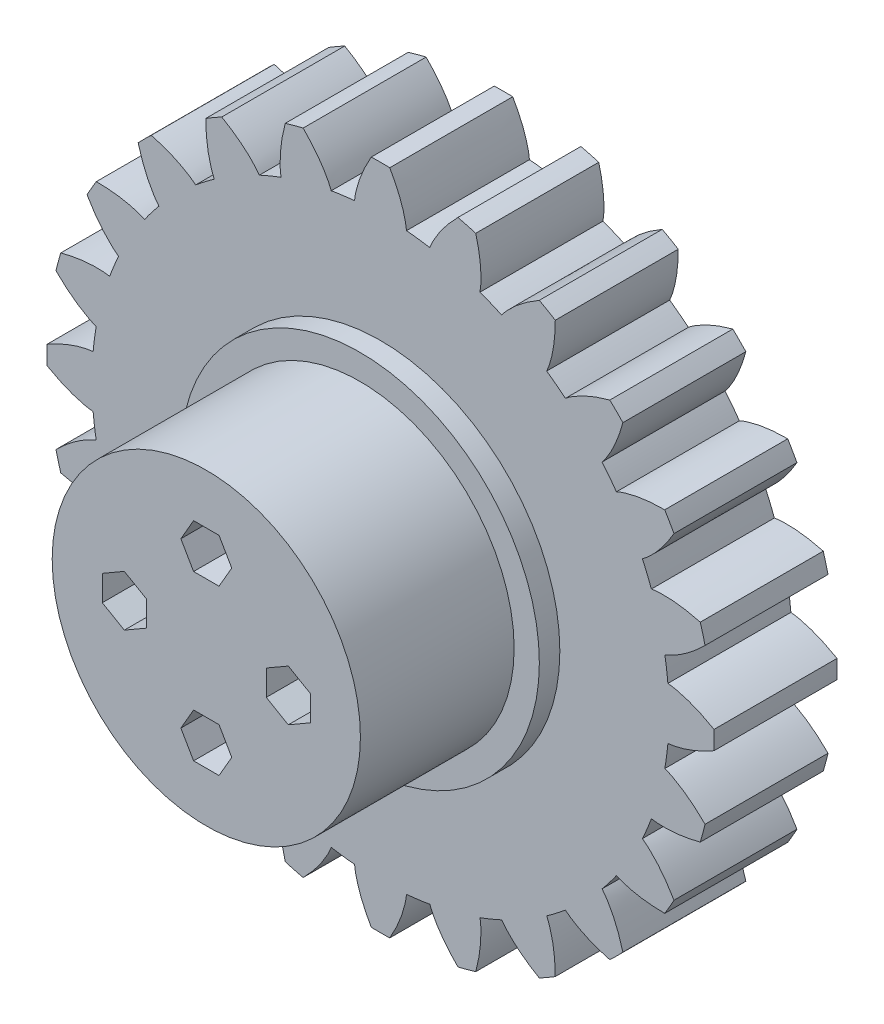
from build123d import *
from build123d.topology import SkipClean

# Parameters (mm, degrees)
SKETCH5_R            = 14.078874537
SKETCH5_R_2          = 1.5
EXTRUDE_BODY_DEPTH   = 3
EXTRUDE_TOOTH_DEPTH  = 3
CIRPATTERN1_COUNT    = 24
CUT_SPOKE_DEPTH      = 24.21644933
PATTERN_SPOKES_COUNT = 3
SCALE1_SCALE         = 2
SKETCH9_R            = 24.50429738
BOSS_EXTRUDE1_DEPTH  = 12
SKETCH10_R           = 17.5
BOSS_EXTRUDE2_DEPTH  = 2
SKETCH11_R           = 15.04
BOSS_EXTRUDE3_DEPTH  = 15
SKETCH12_R           = 1.1
CUT_EXTRUDE1_DEPTH   = 20
CUT_EXTRUDE2_DEPTH   = 29
CIRPATTERN2_COUNT    = 4
SKETCH14_R           = 3.431595381
SKETCH14_R_2         = 3.329011985
SKETCH14_R_3         = 3.465264164
SKETCH14_R_4         = 3.356633273
BOSS_EXTRUDE4_DEPTH  = 4
CUT_EXTRUDE3_REACH   = 56.415
SKETCH15_R           = 1.1


with BuildPart() as part:
    # Sketch5 → Extrude Body (new, symmetric)
    with BuildSketch(Plane.XY):
        Circle(SKETCH5_R)
        Circle(SKETCH5_R_2, mode=Mode.SUBTRACT)
    extrude(amount=EXTRUDE_BODY_DEPTH, both=True)

    # Sketch6 → Extrude Tooth (add, symmetric)
    with BuildSketch(Plane.XY):
        with BuildLine():
            Line((1.274269027, 13.788607604), (0.138033757, 1.493635391))
            ThreePointArc((0.138033757, 1.493635391), (0, 1.5), (-0.138033757, 1.493635391))
            Line((-0.138033757, 1.493635391), (-1.274269027, 13.788607604))
            add(Edge.make_bspline(
                [(-1.274269027, 13.788607604), (-1.281655886, 14.009204475), (-1.145793676, 14.886152234), (-0.779387603, 15.700986555), (-0.45055771, 16.272638198)],
                knots=[0, 0, 0, 0, 0.250018961, 1, 1, 1, 1], degree=3))
            ThreePointArc((-0.45055771, 16.272638198), (0, 16.278874537), (0.45055771, 16.272638198))
            add(Edge.make_bspline(
                [(1.274269027, 13.788607604), (1.281655886, 14.009204475), (1.145793676, 14.886152234), (0.779387603, 15.700986555), (0.45055771, 16.272638198)],
                knots=[0, 0, 0, 0, 0.250018961, 1, 1, 1, 1], degree=3))
        make_face()
    extrude_tooth = extrude(amount=EXTRUDE_TOOTH_DEPTH, both=True)

    # CirPattern1: Extrude Tooth ×24 about axis
    with SkipClean():  # the faces are left unmerged after this step: merging them gives an invalid solid
        cirpattern1_axis = Axis((0, 0, 3), (0, 0, -1))
        for i in range(1, CIRPATTERN1_COUNT):
            add(extrude_tooth.rotate(cirpattern1_axis, i * 360 / CIRPATTERN1_COUNT))

    # Sketch8 → Cut Spoke (cut, symmetric)
    with SkipClean():  # the faces are left unmerged after this step: merging them gives an invalid solid
        with BuildSketch(Plane.XY):
            with BuildLine():
                Line((1.5, 9.763898398), (1.5, 4.898979486))
                ThreePointArc((1.5, 4.898979486), (1.647197135, 4.376746518), (2.045454545, 4.008255943))
                ThreePointArc((2.045454545, 4.008255943), (3.897114317, 2.25), (4.493978744, -0.232712373))
                ThreePointArc((4.493978744, -0.232712373), (4.613972238, -0.761858695), (4.992640687, -1.150451637))
                Line((4.992640687, -1.150451637), (9.205784053, -3.582911093))
                ThreePointArc((9.205784053, -3.582911093), (10.083315936, -3.642882276), (10.668766975, -2.986448098))
                ThreePointArc((10.668766975, -2.986448098), (9.594586794, 5.539437268), (2.748043568, 10.732647276))
                ThreePointArc((2.748043568, 10.732647276), (1.886829374, 10.553848893), (1.5, 9.763898398))
            make_face()
        cut_spoke = extrude(amount=CUT_SPOKE_DEPTH, both=True, mode=Mode.SUBTRACT)

    # Pattern Spokes: Cut Spoke ×3 about axis
    with SkipClean():  # the faces are left unmerged after this step: merging them gives an invalid solid
        pattern_spokes_axis = Axis((0, 0, 0), (0, 0, 1))
        for i in range(1, PATTERN_SPOKES_COUNT):
            add(cut_spoke.rotate(pattern_spokes_axis, i * 360 / PATTERN_SPOKES_COUNT), mode=Mode.SUBTRACT)


with BuildPart() as part_1:
    # Scale1: scaled about (-5.63e-06, -6.117e-06, 0)
    add(part.part.scale(SCALE1_SCALE).moved(Location((5.63e-06, 6.117e-06, 0))))

    # Sketch9 → Boss-Extrude1 (add)
    with BuildSketch(Plane.XY.offset(6)):
        Circle(SKETCH9_R)
    extrude(amount=-BOSS_EXTRUDE1_DEPTH)

    # Sketch10 → Boss-Extrude2 (add)
    with BuildSketch(Plane.XY.offset(6)):
        Circle(SKETCH10_R)
    extrude(amount=BOSS_EXTRUDE2_DEPTH)

    # Sketch11 → Boss-Extrude3 (add)
    with BuildSketch(Plane.XY.offset(8)):
        Circle(SKETCH11_R)
    extrude(amount=BOSS_EXTRUDE3_DEPTH)

    # Sketch12 → Cut-Extrude1 (cut)
    with BuildSketch(Plane(origin=(0, 0, -6), x_dir=(-1, 0, 0), z_dir=(0, 0, -1))):
        with Locations((0, 8)):
            Circle(SKETCH12_R)
        with Locations((8, 0)):
            Circle(SKETCH12_R)
        with Locations((0, -8)):
            Circle(SKETCH12_R)
        with Locations((-8, 0)):
            Circle(SKETCH12_R)
    extrude(amount=-CUT_EXTRUDE1_DEPTH, mode=Mode.SUBTRACT)

    # Sketch13 → Cut-Extrude2 (cut)
    with BuildSketch(Plane(origin=(0, 0, -6), x_dir=(-1, 0, 0), z_dir=(0, 0, -1))):
        Polygon((1.241303079, -10.15), (-1.241303079, -10.15), (-2.482606158, -8), (-1.241303079, -5.85), (1.241303079, -5.85), (2.482606158, -8), align=None)
    cut_extrude2 = extrude(amount=-CUT_EXTRUDE2_DEPTH, mode=Mode.SUBTRACT)

    # CirPattern2: Cut-Extrude2 ×4 about axis
    cirpattern2_axis = Axis((0, 0, 0), (0, 0, 1))
    for i in range(1, CIRPATTERN2_COUNT):
        add(cut_extrude2.rotate(cirpattern2_axis, i * 360 / CIRPATTERN2_COUNT), mode=Mode.SUBTRACT)

    # Sketch14 → Boss-Extrude4 (add)
    with BuildSketch(Plane(origin=(0, 0, -6), x_dir=(-1, 0, 0), z_dir=(0, 0, -1))):
        with Locations((8, 0)):
            Circle(SKETCH14_R)
        with Locations((0, -8)):
            Circle(SKETCH14_R_2)
        with Locations((-8, 0)):
            Circle(SKETCH14_R_3)
        with Locations((0, 8)):
            Circle(SKETCH14_R_4)
    extrude(amount=-BOSS_EXTRUDE4_DEPTH)

    # Sketch15 → Cut-Extrude3 (cut, up to next)
    with BuildSketch(Plane(origin=(0, 0, -6), x_dir=(-1, 0, 0), z_dir=(0, 0, -1)), mode=Mode.PRIVATE) as cut_extrude3_sk1:
        with Locations((8, 0)):
            Circle(SKETCH15_R)
    cut_extrude3_tool1 = extrude(cut_extrude3_sk1.sketch, amount=-CUT_EXTRUDE3_REACH, mode=Mode.PRIVATE) & part_1.part
    # Sketch15 → Cut-Extrude3 (cut, up to next)
    with BuildSketch(Plane(origin=(0, 0, -6), x_dir=(-1, 0, 0), z_dir=(0, 0, -1)), mode=Mode.PRIVATE) as cut_extrude3_sk2:
        with Locations((0, -8)):
            Circle(SKETCH15_R)
    cut_extrude3_tool2 = extrude(cut_extrude3_sk2.sketch, amount=-CUT_EXTRUDE3_REACH, mode=Mode.PRIVATE) & part_1.part
    # Sketch15 → Cut-Extrude3 (cut, up to next)
    with BuildSketch(Plane(origin=(0, 0, -6), x_dir=(-1, 0, 0), z_dir=(0, 0, -1)), mode=Mode.PRIVATE) as cut_extrude3_sk3:
        with Locations((-8, 0)):
            Circle(SKETCH15_R)
    cut_extrude3_tool3 = extrude(cut_extrude3_sk3.sketch, amount=-CUT_EXTRUDE3_REACH, mode=Mode.PRIVATE) & part_1.part
    # Sketch15 → Cut-Extrude3 (cut, up to next)
    with BuildSketch(Plane(origin=(0, 0, -6), x_dir=(-1, 0, 0), z_dir=(0, 0, -1)), mode=Mode.PRIVATE) as cut_extrude3_sk4:
        with Locations((0, 8)):
            Circle(SKETCH15_R)
    cut_extrude3_tool4 = extrude(cut_extrude3_sk4.sketch, amount=-CUT_EXTRUDE3_REACH, mode=Mode.PRIVATE) & part_1.part
    add(cut_extrude3_tool1.solids().sort_by_distance((-8, 0, -6))[0], mode=Mode.SUBTRACT)
    add(cut_extrude3_tool2.solids().sort_by_distance((0, -8, -6))[0], mode=Mode.SUBTRACT)
    add(cut_extrude3_tool3.solids().sort_by_distance((8, 0, -6))[0], mode=Mode.SUBTRACT)
    add(cut_extrude3_tool4.solids().sort_by_distance((0, 8, -6))[0], mode=Mode.SUBTRACT)


solid = part_1.part
